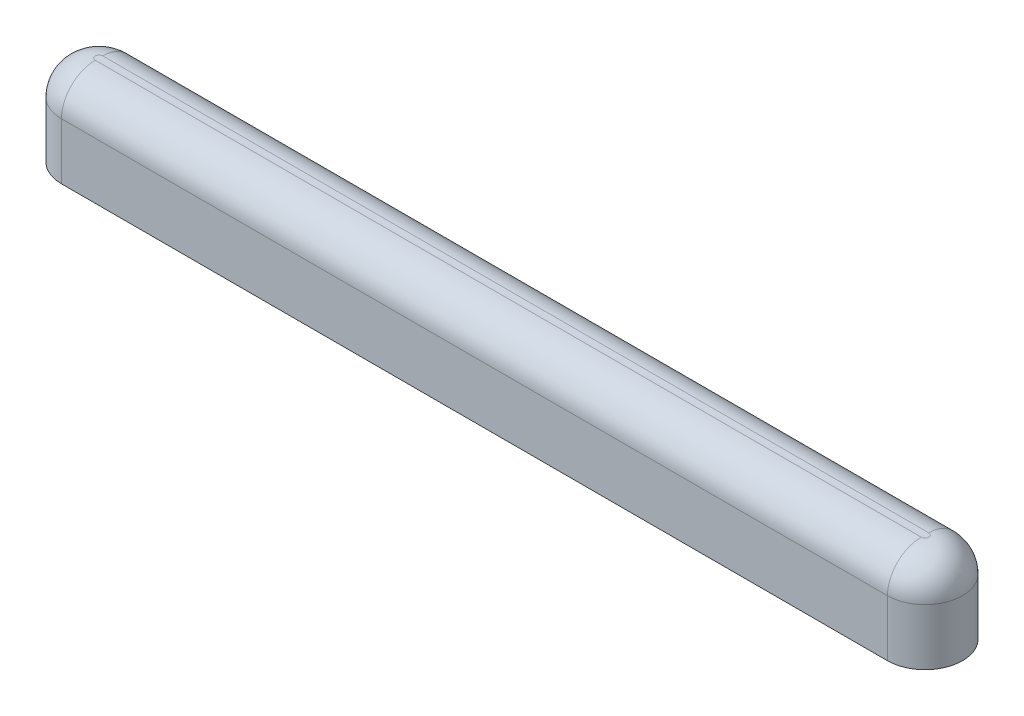
from build123d import *

# Parameters (mm, degrees)
BOSS_EXTRUDE1_DEPTH = 12
FILLET1_R           = 4.5


with BuildPart() as part:
    # Sketch1 → Boss-Extrude1 (new body)
    with BuildSketch(Plane(origin=(0, 0, 0), x_dir=(1, 0, 0), z_dir=(0, 1, 0))):
        with BuildLine():
            Line((-55, 5), (55, 5))
            ThreePointArc((55, 5), (60, 0), (55, -5))
            Line((55, -5), (-55, -5))
            ThreePointArc((-55, -5), (-60, 0), (-55, 5))
        make_face()
    extrude(amount=BOSS_EXTRUDE1_DEPTH)

    # Fillet1
    fillet1_edges = [part.edges().sort_by_distance(p)[0] for p in [
        (0, 12, -5),
        (60, 12, 0),
        (0, 12, 5),
        (-60, 12, 0),
    ]]
    fillet(fillet1_edges, radius=FILLET1_R)


solid = part.part
